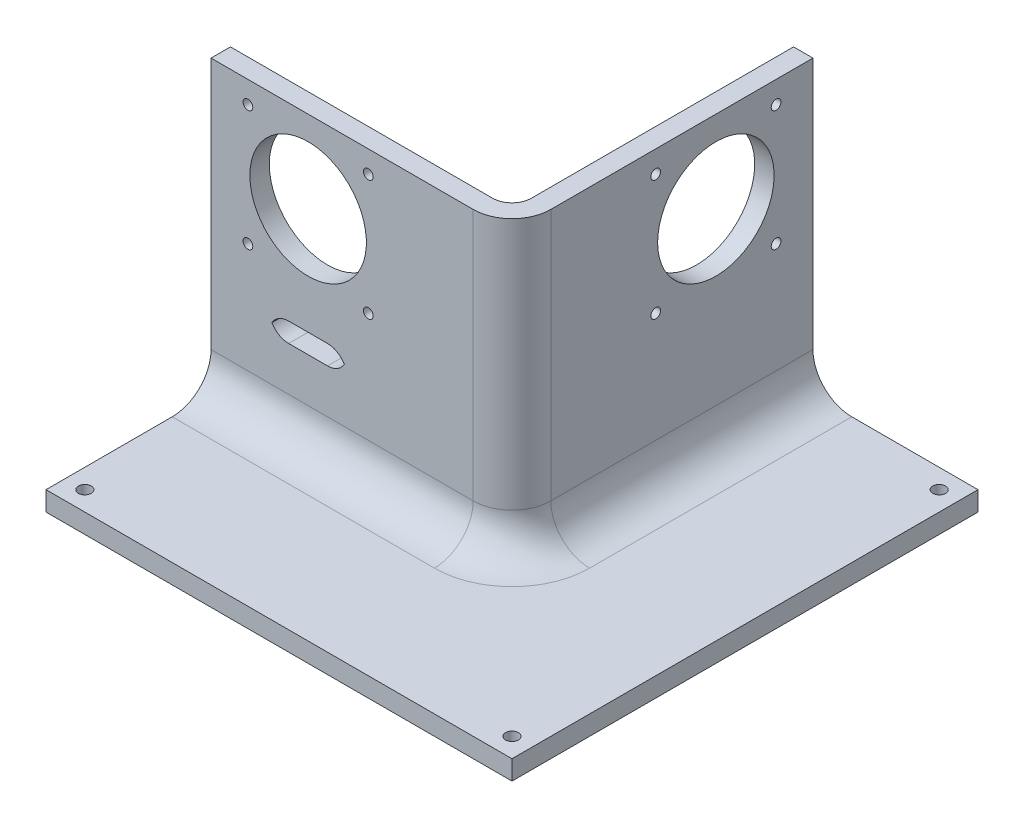
from build123d import *

# Parameters (mm, degrees)
BOSS_EXTRUDE1_DEPTH = 20
SKETCH2_W           = 5
SKETCH2_H           = 72.5
BOSS_EXTRUDE2_DEPTH = 60
SKETCH3_R           = 15
CUT_EXTRUDE1_DEPTH  = 100
SKETCH4_R           = 1.25
CUT_EXTRUDE2_DEPTH  = 100
SKETCH7_W           = 77.5
SKETCH7_H           = 5
BOSS_EXTRUDE6_DEPTH = 60
FILLET3_R           = 5
SKETCH8_W           = 25
SKETCH8_H           = 120
SKETCH8_H_2         = 25
SKETCH8_W_2         = 120
CUT_EXTRUDE3_DEPTH  = 100
SKETCH9_R           = 1.65
CUT_EXTRUDE4_DEPTH  = 100
SKETCH10_W          = 42.5
SKETCH10_H          = 42.5
SKETCH10_W_2        = 77.5
SKETCH10_H_2        = 77.5
CUT_EXTRUDE5_DEPTH  = 15
FILLET4_R           = 10
SKETCH11_W          = 20
SKETCH11_H          = 5
CUT_EXTRUDE6_DEPTH  = 6
FILLET5_R           = 5


with BuildPart() as part:
    # Sketch1 → Boss-Extrude1 (new body)
    with BuildSketch(Plane(origin=(0, 0, 0), x_dir=(1, 0, 0), z_dir=(0, 1, 0))):
        Polygon((72.5, 72.5), (0, 72.5), (0, 0), (-72.5, 0), (-72.5, -72.5), (72.5, -72.5), align=None)
    extrude(amount=BOSS_EXTRUDE1_DEPTH)

    # Sketch2 → Boss-Extrude2 (add)
    with BuildSketch(Plane(origin=(0, 20, 0), x_dir=(1, 0, 0), z_dir=(0, 1, 0))):
        with Locations((2.5, 36.25)):
            Rectangle(SKETCH2_W, SKETCH2_H)
    extrude(amount=BOSS_EXTRUDE2_DEPTH)

    # Sketch3 → Cut-Extrude1 (cut)
    with BuildSketch(Plane.ZY):
        with Locations((-47.5, 58.85)):
            Circle(SKETCH3_R)
    cut_extrude1 = extrude(amount=-CUT_EXTRUDE1_DEPTH, mode=Mode.SUBTRACT)

    # Sketch4 → Cut-Extrude2 (cut)
    with BuildSketch(Plane.ZY):
        with Locations((-32, 74.35)):
            Circle(SKETCH4_R)
        with Locations((-63, 74.35)):
            Circle(SKETCH4_R)
        with Locations((-63, 43.35)):
            Circle(SKETCH4_R)
        with Locations((-32, 43.35)):
            Circle(SKETCH4_R)
    cut_extrude2 = extrude(amount=-CUT_EXTRUDE2_DEPTH, mode=Mode.SUBTRACT)

    # Sketch7 → Boss-Extrude6 (add)
    with BuildSketch(Plane(origin=(0, 20, 0), x_dir=(1, 0, 0), z_dir=(0, 1, 0))):
        with Locations((-33.75, -2.5)):
            Rectangle(SKETCH7_W, SKETCH7_H)
    extrude(amount=BOSS_EXTRUDE6_DEPTH)

    # Mirror5: Cut-Extrude1, Cut-Extrude2 across plane
    add(cut_extrude1.mirror(Plane(origin=(0, 0, 0), x_dir=(0.7071067811865476, 0, 0.7071067811865475), z_dir=(-0.7071067811865475, 0, 0.7071067811865476))), mode=Mode.SUBTRACT)
    add(cut_extrude2.mirror(Plane(origin=(0, 0, 0), x_dir=(0.7071067811865476, 0, 0.7071067811865475), z_dir=(-0.7071067811865475, 0, 0.7071067811865476))), mode=Mode.SUBTRACT)

    # Fillet3
    fillet3_edges = [part.edges().sort_by_distance(p)[0] for p in [
        (0, 40, 0),
    ]]
    fillet(fillet3_edges, radius=FILLET3_R)

    # Sketch8 → Cut-Extrude3 (cut)
    with BuildSketch(Plane(origin=(0, 20, 0), x_dir=(1, 0, 0), z_dir=(0, 1, 0))):
        with Locations((60, 12.5)):
            Rectangle(SKETCH8_W, SKETCH8_H)
        with Locations((60, -60)):
            Rectangle(SKETCH8_W, SKETCH8_H_2)
        with Locations((-12.5, -60)):
            Rectangle(SKETCH8_W_2, SKETCH8_H_2)
    extrude(amount=-CUT_EXTRUDE3_DEPTH, mode=Mode.SUBTRACT)

    # Sketch9 → Cut-Extrude4 (cut)
    with BuildSketch(Plane(origin=(0, 20, 0), x_dir=(1, 0, 0), z_dir=(0, 1, 0))):
        with Locations(Location((42.5, 67.5, 0), (0, 0, 270))):
            Circle(SKETCH9_R)
        with Locations(Location((42.5, -42.5, 0), (0, 0, 270))):
            Circle(SKETCH9_R)
        with Locations(Location((-67.5, -42.5, 0), (0, 0, 270))):
            Circle(SKETCH9_R)
    extrude(amount=-CUT_EXTRUDE4_DEPTH, mode=Mode.SUBTRACT)

    # Sketch10 → Cut-Extrude5 (cut)
    with BuildSketch(Plane(origin=(0, 20, 0), x_dir=(1, 0, 0), z_dir=(0, 1, 0))):
        with Locations((26.25, -26.25)):
            Rectangle(SKETCH10_W, SKETCH10_H)
        with Locations((-33.75, -26.25)):
            Rectangle(SKETCH10_W_2, SKETCH10_H)
        with Locations((26.25, 33.75)):
            Rectangle(SKETCH10_W, SKETCH10_H_2)
    extrude(amount=-CUT_EXTRUDE5_DEPTH, mode=Mode.SUBTRACT)

    # Fillet4
    fillet4_edges = [part.edges().sort_by_distance(p)[0] for p in [
        (5, 5, -33.75),
        (-33.75, 5, 5),
        (5, 42.5, 5),
    ]]
    fillet(fillet4_edges, radius=FILLET4_R)

    # Sketch11 → Cut-Extrude6 (cut)
    with BuildSketch(Plane.XY.offset(5)):
        with Locations((-47.5, 28.85)):
            Rectangle(SKETCH11_W, SKETCH11_H)
    extrude(amount=-CUT_EXTRUDE6_DEPTH, mode=Mode.SUBTRACT)

    # Fillet5
    # the kernel refuses this fillet: 5 mm, written as the material it adds along each edge
    with BuildSketch(Plane(origin=(-57.5, 26.35, 5), x_dir=(1, 0, 0), z_dir=(0, 0, -1))) as fillet5_piece_1:
        with BuildLine():
            CenterArc((FILLET5_R, -FILLET5_R), FILLET5_R, 90, 90)
            Line((0, -FILLET5_R), (0, 0))
            Line((0, 0), (FILLET5_R, 0))
        make_face()
    extrude(amount=5)
    with BuildSketch(Plane(origin=(-57.5, 31.35, 5), x_dir=(1, 0, 0), z_dir=(0, 0, -1)), Plane(origin=(-37.5, 31.35, 5), x_dir=(0, -1, 0), z_dir=(0, 0, -1)), Plane(origin=(-37.5, 26.35, 5), x_dir=(-1, 0, 0), z_dir=(0, 0, -1))) as fillet5_piece_2:
        with BuildLine():
            CenterArc((FILLET5_R, FILLET5_R), FILLET5_R, 180, 90)
            Line((0, FILLET5_R), (0, 0))
            Line((0, 0), (FILLET5_R, 0))
        make_face()
    extrude(amount=5)


solid = part.part
